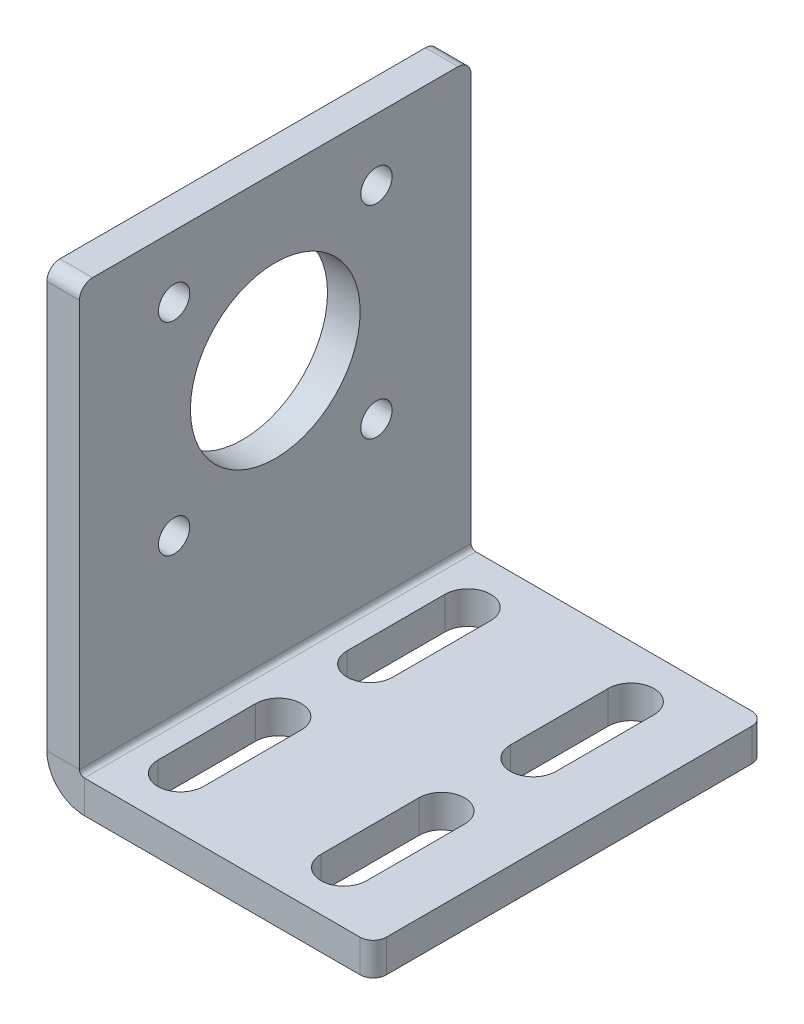
from build123d import *

# Parameters (mm, degrees)
SM_BASE_FLANGE_1_DEPTH   = 60
SKETCH_6_R               = 13
CUT_EXTRUDE_1_DEPTH      = 5
HOLE_WIZARD_M4_1_D       = 4.8
PATTERN_CIRCULAR_1_COUNT = 4
CUT_EXTRUDE_2_DEPTH      = 5
MIRROR_3_COPY_1_DEPTH    = 5
FILLET_1_R               = 2


# Sheet-metal steps are written as plain solids
with BuildPart() as part:
    # Sketch 1 → 基体-法兰1 (new body)
    with BuildSketch(Plane.XY):
        with BuildLine():
            Line((0, 70), (0, 5.7366))
            ThreePointArc((0, 5.7366), (1.680211239, 1.680211239), (5.7366, 0))
            Line((5.7366, 0), (50, 0))
            Line((50, 0), (50, 5))
            Line((50, 5), (5.7366, 5))
            ThreePointArc((5.7366, 5), (5.215745145, 5.215745145), (5, 5.7366))
            Line((5, 5.7366), (5, 70))
            Line((5, 70), (0, 70))
        make_face()
    extrude(amount=SM_BASE_FLANGE_1_DEPTH)

    # 草图6 → 切除-拉伸1 (cut)
    with BuildSketch(Plane(origin=(5, 0, 0), x_dir=(0, 0, -1), z_dir=(1, 0, 0))):
        with Locations((-30, 45)):
            Circle(SKETCH_6_R)
    extrude(amount=-CUT_EXTRUDE_1_DEPTH, mode=Mode.SUBTRACT)

    # M4 间隙孔1 (through all)
    with Locations(Plane(origin=(5, 60.5, 45.5), x_dir=(0, 0, 1), z_dir=(1, 0, 0))):
        with Locations((0, 0)):
            hole_wizard_m4_1 = Hole(HOLE_WIZARD_M4_1_D / 2)

    # 阵列(圆周)1: M4 间隙孔1 ×4 about axis
    pattern_circular_1_axis = Axis((0, 45, 30), (1, 0, 0))
    for i in range(1, PATTERN_CIRCULAR_1_COUNT):
        add(hole_wizard_m4_1.rotate(pattern_circular_1_axis, i * 360 / PATTERN_CIRCULAR_1_COUNT), mode=Mode.SUBTRACT)

    # 草图9 → 切除-拉伸2 (cut)
    with BuildSketch(Plane(origin=(0, 5, 0), x_dir=(1, 0, 0), z_dir=(0, 1, 0))):
        with BuildLine():
            Line((41, -37), (41, -52))
            ThreePointArc((41, -52), (37.5, -55.5), (34, -52))
            Line((34, -52), (34, -37))
            ThreePointArc((34, -37), (37.5, -33.5), (41, -37))
        make_face()
    cut_extrude_2 = extrude(amount=-CUT_EXTRUDE_2_DEPTH, mode=Mode.SUBTRACT)

    # 镜向2: 切除-拉伸2 across plane
    add(cut_extrude_2.mirror(Plane(origin=(25, 0, 0), x_dir=(0, 0, 1), z_dir=(1, 0, 0))), mode=Mode.SUBTRACT)

    # 镜向3: 切除-拉伸2 across plane
    add(cut_extrude_2.mirror(Plane.XY.offset(30)), mode=Mode.SUBTRACT)

    # 镜向3 copy 1 sketch → 镜向3 copy 1 (cut)
    with BuildSketch(Plane(origin=(50, 5, 60), x_dir=(-1, 0, 0), z_dir=(0, 1, 0))):
        with BuildLine():
            Line((41, -37), (41, -52))
            ThreePointArc((41, -52), (37.5, -55.5), (34, -52))
            Line((34, -52), (34, -37))
            ThreePointArc((34, -37), (37.5, -33.5), (41, -37))
        make_face()
    extrude(amount=-MIRROR_3_COPY_1_DEPTH, mode=Mode.SUBTRACT)

    # 圆角1
    fillet_1_edges = [part.edges().sort_by_distance(p)[0] for p in [
        (50, 2.5, 60),
        (50, 2.5, 0),
        (2.5, 70, 60),
        (2.5, 70, 0),
    ]]
    fillet(fillet_1_edges, radius=FILLET_1_R)


solid = part.part
